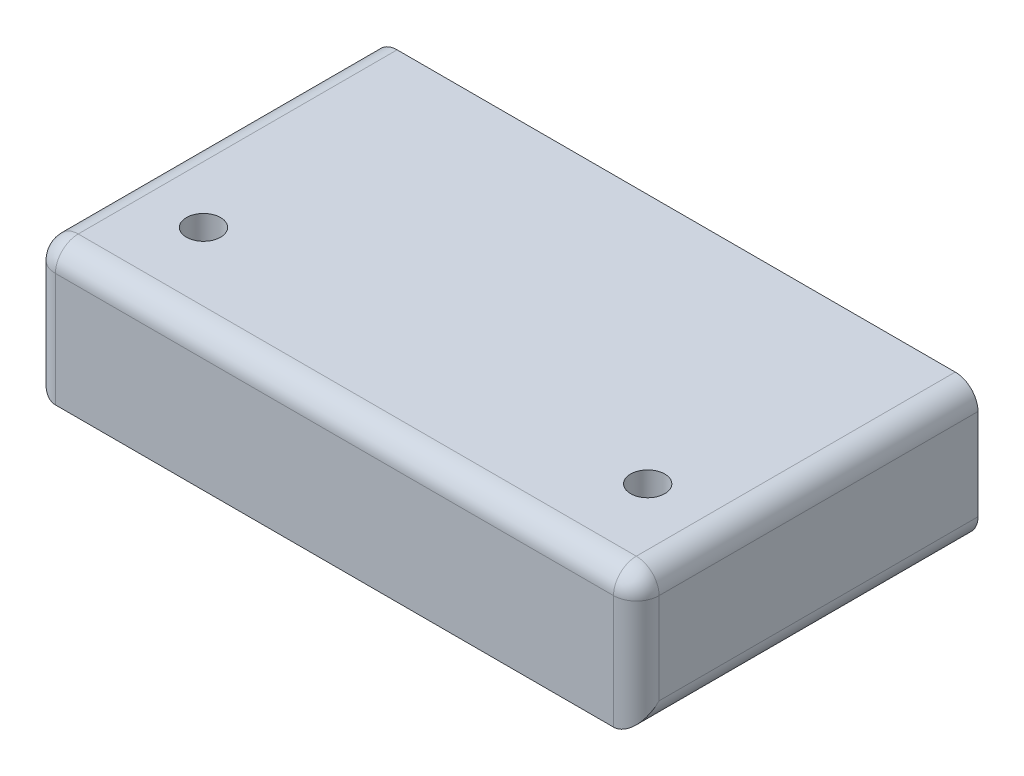
from build123d import *

# Parameters (mm, degrees)
SKETCH1_W           = 53
SKETCH1_H           = 12
BOSS_EXTRUDE1_DEPTH = 30
CUT_EXTRUDE1_REACH  = 43.788
SKETCH2_R           = 1.5
FILLET1_R           = 2


with BuildPart() as part:
    # Sketch1 → Boss-Extrude1 (new body)
    with BuildSketch(Plane.XY):
        Rectangle(SKETCH1_W, SKETCH1_H)
    extrude(amount=BOSS_EXTRUDE1_DEPTH)

    # Sketch2 → Cut-Extrude1 (cut, up to next)
    with BuildSketch(Plane.XZ.offset(6), mode=Mode.PRIVATE) as cut_extrude1_sk1:
        with Locations((-19.5, 22)):
            Circle(SKETCH2_R)
    cut_extrude1_tool1 = extrude(cut_extrude1_sk1.sketch, amount=-CUT_EXTRUDE1_REACH, mode=Mode.PRIVATE) & part.part
    # Sketch2 → Cut-Extrude1 (cut, up to next)
    with BuildSketch(Plane.XZ.offset(6), mode=Mode.PRIVATE) as cut_extrude1_sk2:
        with Locations((19.5, 22)):
            Circle(SKETCH2_R)
    cut_extrude1_tool2 = extrude(cut_extrude1_sk2.sketch, amount=-CUT_EXTRUDE1_REACH, mode=Mode.PRIVATE) & part.part
    add(cut_extrude1_tool1.solids().sort_by_distance((-19.5, -6, 22))[0], mode=Mode.SUBTRACT)
    add(cut_extrude1_tool2.solids().sort_by_distance((19.5, -6, 22))[0], mode=Mode.SUBTRACT)

    # Fillet1
    fillet1_edges = [part.edges().sort_by_distance(p)[0] for p in [
        (26.5, 0, 30),
        (0, 6, 30),
        (-26.5, 0, 30),
        (-26.5, 6, 15),
        (26.5, 6, 15),
        (26.5, -6, 15),
        (-26.5, -6, 15),
    ]]
    fillet(fillet1_edges, radius=FILLET1_R)


solid = part.part
